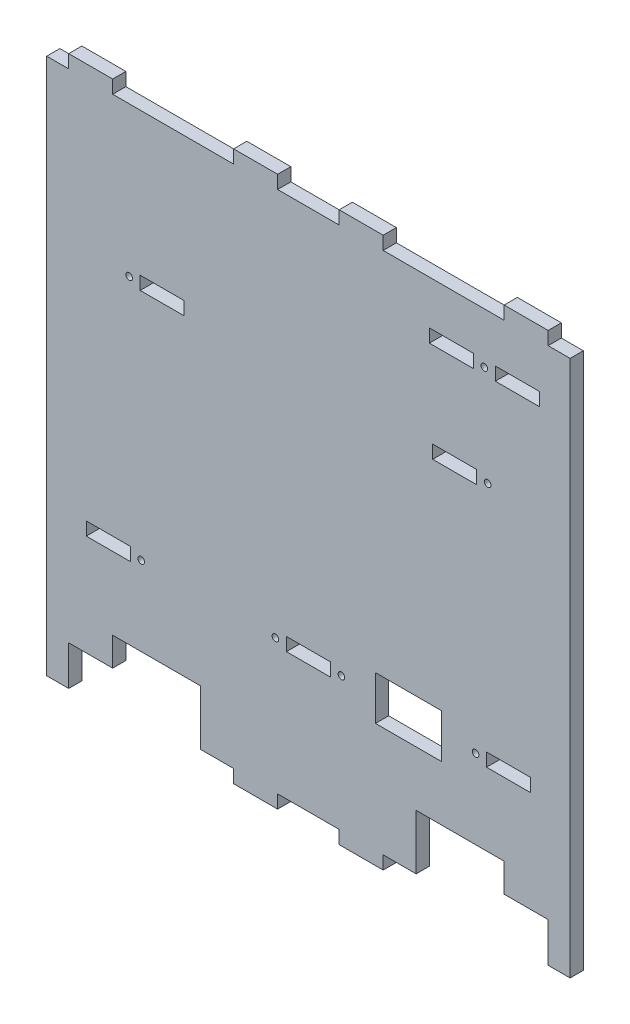
from build123d import *

# Parameters (mm, degrees)
ESQUISSE1_W             = 218
ESQUISSE1_H             = 238
ESQUISSE1_W_2           = 20
ESQUISSE1_H_2           = 6
ESQUISSE1_W_3           = 30
ESQUISSE1_H_3           = 20
BOSS_EXTRU_1_DEPTH      = 6
ESQUISSE2_W             = 40
ESQUISSE2_H             = 25
ENL_V_MAT_EXTRU_1_DEPTH = 6
ESQUISSE3_W             = 20
ESQUISSE3_H             = 6
BOSS_EXTRU_3_DEPTH      = 6
ESQUISSE4_R             = 1.5
ENL_V_MAT_EXTRU_2_DEPTH = 6
ESQUISSE5_W             = 10
ESQUISSE5_H             = 244
BOSS_EXTRU_4_DEPTH      = 6
ESQUISSE6_W             = 20
ESQUISSE6_H             = 12
ENL_V_MAT_EXTRU_3_DEPTH = 6


with BuildPart() as part:
    # Esquisse1 → Boss.-Extru.1 (new body)
    with BuildSketch(Plane.XY):
        Rectangle(ESQUISSE1_W, ESQUISSE1_H)
        with Locations((-91, -58)):
            Rectangle(ESQUISSE1_W_2, ESQUISSE1_H_2, mode=Mode.SUBTRACT)
        with Locations((0, -58)):
            Rectangle(ESQUISSE1_W_2, ESQUISSE1_H_2, mode=Mode.SUBTRACT)
        with Locations((91, -58)):
            Rectangle(ESQUISSE1_W_2, ESQUISSE1_H_2, mode=Mode.SUBTRACT)
        with Locations((-66.5, 51)):
            Rectangle(ESQUISSE1_W_2, ESQUISSE1_H_2, mode=Mode.SUBTRACT)
        with Locations((66.5, 51)):
            Rectangle(ESQUISSE1_W_2, ESQUISSE1_H_2, mode=Mode.SUBTRACT)
        with Locations((45.5, -59)):
            Rectangle(ESQUISSE1_W_3, ESQUISSE1_H_3, mode=Mode.SUBTRACT)
        with Locations((65, 96)):
            Rectangle(ESQUISSE1_W_2, ESQUISSE1_H_2, mode=Mode.SUBTRACT)
        with Locations((95, 96)):
            Rectangle(ESQUISSE1_W_2, ESQUISSE1_H_2, mode=Mode.SUBTRACT)
    extrude(amount=BOSS_EXTRU_1_DEPTH)

    # Esquisse2 → Enlèv. mat.-Extru.1 (cut)
    with BuildSketch(Plane.XY.offset(6)):
        with Locations((-69, -106.5)):
            Rectangle(ESQUISSE2_W, ESQUISSE2_H)
        with Locations((69, -106.5)):
            Rectangle(ESQUISSE2_W, ESQUISSE2_H)
    extrude(amount=-ENL_V_MAT_EXTRU_1_DEPTH, mode=Mode.SUBTRACT)

    # Esquisse3 → Boss.-Extru.3 (add)
    with BuildSketch(Plane.XY.offset(6)):
        with Locations((-24, -122)):
            Rectangle(ESQUISSE3_W, ESQUISSE3_H)
        with Locations((24, -122)):
            Rectangle(ESQUISSE3_W, ESQUISSE3_H)
        with Locations((24, 122)):
            Rectangle(ESQUISSE3_W, ESQUISSE3_H)
        with Locations((99, 122)):
            Rectangle(ESQUISSE3_W, ESQUISSE3_H)
        with Locations((-24, 122)):
            Rectangle(ESQUISSE3_W, ESQUISSE3_H)
        with Locations((-99, 122)):
            Rectangle(ESQUISSE3_W, ESQUISSE3_H)
    extrude(amount=-BOSS_EXTRU_3_DEPTH)

    # Esquisse4 → Enlèv. mat.-Extru.2 (cut)
    with BuildSketch(Plane.XY.offset(6)):
        with Locations((-15, -58)):
            Circle(ESQUISSE4_R)
        with Locations((-76, -58)):
            Circle(ESQUISSE4_R)
        with Locations((80, 96)):
            Circle(ESQUISSE4_R)
        with Locations((81.5, 51)):
            Circle(ESQUISSE4_R)
        with Locations((76, -58)):
            Circle(ESQUISSE4_R)
        with Locations((15, -58)):
            Circle(ESQUISSE4_R)
        with Locations((-81.5, 51)):
            Circle(ESQUISSE4_R)
    extrude(amount=-ENL_V_MAT_EXTRU_2_DEPTH, mode=Mode.SUBTRACT)

    # Esquisse5 → Boss.-Extru.4 (add)
    with BuildSketch(Plane.XY.offset(6)):
        with Locations((-114, -3)):
            Rectangle(ESQUISSE5_W, ESQUISSE5_H)
        with Locations((114, -3)):
            Rectangle(ESQUISSE5_W, ESQUISSE5_H)
    extrude(amount=-BOSS_EXTRU_4_DEPTH)

    # Esquisse6 → Enlèv. mat.-Extru.3 (cut)
    with BuildSketch(Plane.XY.offset(6)):
        with Locations((99, -113)):
            Rectangle(ESQUISSE6_W, ESQUISSE6_H)
        with Locations((-99, -113)):
            Rectangle(ESQUISSE6_W, ESQUISSE6_H)
    extrude(amount=-ENL_V_MAT_EXTRU_3_DEPTH, mode=Mode.SUBTRACT)


solid = part.part
